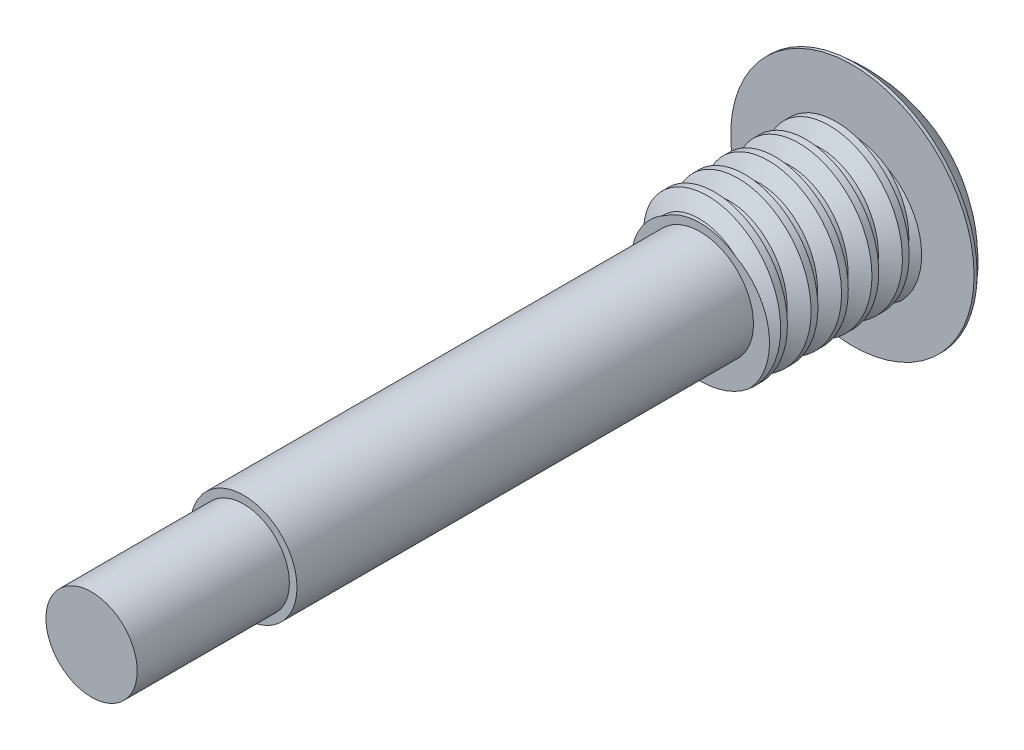
from build123d import *

# Parameters (mm, degrees)
SKETCH3_R           = 3.175
BOSS_EXTRUDE1_DEPTH = 6.35
CUT_SWEEP1_PITCH    = 1.27
SKETCH8_R           = 2.2225
BOSS_EXTRUDE3_DEPTH = 25.4
SKETCH9_R           = 5.08
BOSS_EXTRUDE4_DEPTH = 0.127
DOME3_FACE_RADIUS   = 5.08
DOME3_HEIGHT        = 2.38
SKETCH10_R          = 1.905
BOSS_EXTRUDE5_DEPTH = 6.35


with BuildPart() as part:
    # Sketch3 → Boss-Extrude1 (new body)
    with BuildSketch(Plane.XY):
        Circle(SKETCH3_R)
    extrude(amount=BOSS_EXTRUDE1_DEPTH)

    # Cut-Sweep1: arcs per turn and ends read off the stored shape
    # Cut-Sweep1: the profile of Sketch5 profile screwed along a left-hand helix through 6.5 turns, 8 arcs to a turn; built about Z, then put on its axis
    cut_sweep1_z = Axis((0, 0, 0), (0, 0, 1))
    cut_sweep1_corners = [(2.54, 0, -1.397), (3.1753, 0, -1.763790626), (3.1753, 0, -0.776209374), (2.54, 0, -1.143)]
    with BuildLine(mode=Mode.PRIVATE) as cut_sweep1_profile:
        Line(cut_sweep1_corners[0], cut_sweep1_corners[1])
        Line(cut_sweep1_corners[1], cut_sweep1_corners[2])
        Line(cut_sweep1_corners[2], cut_sweep1_corners[3])
        Line(cut_sweep1_corners[3], cut_sweep1_corners[0])
    cut_sweep1_cap = Face(cut_sweep1_profile.wire())
    cut_sweep1_turn_angles = [0, -22.5, -45, -67.5, -90, -112.5, -135, -157.5, -180, -202.5, -225, -247.5, -270, -292.5, -315, -337.5, -360]
    cut_sweep1_turn_weights = [1, 0.9238795325112867, 1, 0.9238795325112867, 1, 0.9238795325112867, 1, 0.9238795325112867, 1, 0.9238795325112867, 1, 0.9238795325112867, 1, 0.9238795325112867, 1, 0.9238795325112867, 1]
    cut_sweep1_turn_rails = [Edge.make_bspline([Vector(p[0], p[1], 0).rotate(cut_sweep1_z, cut_sweep1_turn_angles[k]) / cut_sweep1_turn_weights[k] + Vector(0, 0, p[2] + -CUT_SWEEP1_PITCH * cut_sweep1_turn_angles[k] / 360) for k in range(17)], [0, 0, 0, 1, 1, 2, 2, 3, 3, 4, 4, 5, 5, 6, 6, 7, 7, 8, 8, 8], 2, cut_sweep1_turn_weights) for p in cut_sweep1_corners]
    cut_sweep1_turn_sides = [Face.make_surface_from_curves(cut_sweep1_turn_rails[p[0]], cut_sweep1_turn_rails[p[1]]) for p in [(0, 1), (1, 2), (2, 3), (3, 0)]]
    cut_sweep1_last_angles = [-2160, -2182.5, -2205, -2227.5, -2250, -2272.5, -2295, -2317.5, -2340]
    cut_sweep1_last_weights = [1, 0.9238795325112867, 1, 0.9238795325112867, 1, 0.9238795325112867, 1, 0.9238795325112867, 1]
    cut_sweep1_last_rails = [Edge.make_bspline([Vector(p[0], p[1], 0).rotate(cut_sweep1_z, cut_sweep1_last_angles[k]) / cut_sweep1_last_weights[k] + Vector(0, 0, p[2] + -CUT_SWEEP1_PITCH * cut_sweep1_last_angles[k] / 360) for k in range(9)], [0, 0, 0, 1, 1, 2, 2, 3, 3, 4, 4, 4], 2, cut_sweep1_last_weights) for p in cut_sweep1_corners]
    cut_sweep1_last_sides = [Face.make_surface_from_curves(cut_sweep1_last_rails[p[0]], cut_sweep1_last_rails[p[1]]) for p in [(0, 1), (1, 2), (2, 3), (3, 0)]]
    cut_sweep1 = Plane(origin=(0, 0, 0), x_dir=(0, 1, 0), z_dir=(0, 0, 1)) * Solid(Shell([*[p.moved(Location((0, 0, CUT_SWEEP1_PITCH * i))) for i in range(6) for p in cut_sweep1_turn_sides], *cut_sweep1_last_sides, cut_sweep1_cap, cut_sweep1_cap.rotate(cut_sweep1_z, -2340).moved(Location((0, 0, -CUT_SWEEP1_PITCH * -2340 / 360)))]))
    add(cut_sweep1, mode=Mode.SUBTRACT)

    # Sketch8 → Boss-Extrude3 (add)
    with BuildSketch(Plane.XY):
        Circle(SKETCH8_R)
    extrude(amount=BOSS_EXTRUDE3_DEPTH)

    # Sketch9 → Boss-Extrude4 (add)
    with BuildSketch(Plane.XY):
        Circle(SKETCH9_R)
    extrude(amount=-BOSS_EXTRUDE4_DEPTH)

    # Dome3: a dome of height H over a round flat face of radius A is a cap of a sphere of radius (A * A + H * H) / (2 * H)
    dome3_r = (DOME3_FACE_RADIUS * DOME3_FACE_RADIUS + DOME3_HEIGHT * DOME3_HEIGHT) / (2 * DOME3_HEIGHT)
    dome3_base = Plane((0, 0, -0.127), z_dir=(0, 0, -1))
    with Locations(dome3_base.offset(DOME3_HEIGHT - dome3_r)):
        dome3_ball = Sphere(dome3_r, mode=Mode.PRIVATE)
    add(split(dome3_ball, bisect_by=dome3_base, keep=Keep.TOP, mode=Mode.PRIVATE))

    # Sketch10 → Boss-Extrude5 (add)
    with BuildSketch(Plane.XY.offset(25.4)):
        Circle(SKETCH10_R)
    extrude(amount=BOSS_EXTRUDE5_DEPTH)


solid = part.part
